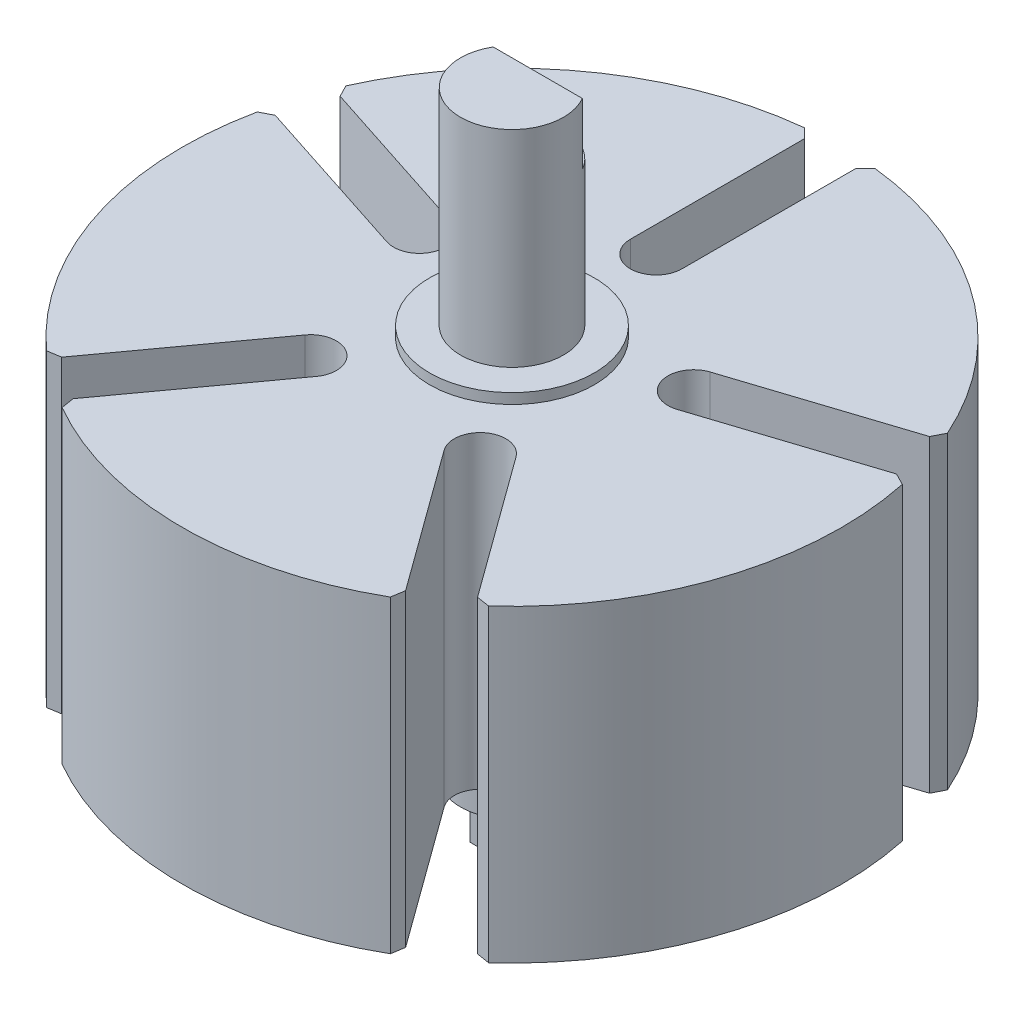
from build123d import *

# Parameters (mm, degrees)
SKETCH_1_R               = 16
EXTRUDE_1_DEPTH          = 15
SKETCH_2_R               = 4
EXTRUDE_2_DEPTH          = 0.5
EXTRUDE_START            = 0.5
SKETCH_3_R               = 4
EXTRUDE_3_DEPTH          = 0.5
SKETCH_4_R               = 2.5
EXTRUDE_4_DEPTH          = 10
EXTRUDE_START_2          = 3
SKETCH_5_R               = 2.5
EXTRUDE_5_DEPTH          = 3
CUT_EXTRUDE_START        = -3
CUT_EXTRUDE_1_DEPTH      = 3
CUT_EXTRUDE_2_DEPTH      = 30.227555491
PATTERN_CIRCULAR_1_COUNT = 5
SKETCH_8_R               = 1.5
EXTRUDE_6_DEPTH          = 3
CHAMFER_1_SIZE           = 0.5
CUT_EXTRUDE_3_DEPTH      = 3


with BuildPart() as part:
    # 草图1 → 凸台-拉伸1 (new body)
    with BuildSketch(Plane(origin=(0, 0, 0), x_dir=(1, 0, 0), z_dir=(0, 1, 0))):
        with Locations(Location((0, 0, 0), (0, 0, 270))):
            Circle(SKETCH_1_R)
    extrude(amount=EXTRUDE_1_DEPTH)

    # 草图2 → 凸台-拉伸2 (add)
    with BuildSketch(Plane(origin=(0, 15, 0), x_dir=(1, 0, 0), z_dir=(0, 1, 0))):
        with Locations(Location((0, 0, 0), (0, 0, 270))):
            Circle(SKETCH_2_R)
    extrude(amount=EXTRUDE_2_DEPTH)

    # 草图3 → 凸台-拉伸3 (add)
    with BuildSketch(Plane.XZ.offset(EXTRUDE_START)):
        with Locations(Location((0, 0, 0), (0, 0, 90))):
            Circle(SKETCH_3_R)
    extrude(amount=-EXTRUDE_3_DEPTH)

    # 草图4 → 凸台-拉伸4 (add)
    with BuildSketch(Plane(origin=(0, 15.5, 0), x_dir=(1, 0, 0), z_dir=(0, 1, 0))):
        with Locations(Location((0, 0, 0), (0, 0, 270))):
            Circle(SKETCH_4_R)
    extrude(amount=EXTRUDE_4_DEPTH)

    # 草图5 → 凸台-拉伸5 (add)
    with BuildSketch(Plane.XZ.offset(0.5).offset(EXTRUDE_START_2)):
        with Locations(Location((0, 0, 0), (0, 0, 90))):
            Circle(SKETCH_5_R)
    extrude(amount=-EXTRUDE_5_DEPTH)

    # 草图6 → 切除-拉伸1 (cut)
    with BuildSketch(Plane(origin=(0, 25.5, 0), x_dir=(1, 0, 0), z_dir=(0, 1, 0)).offset(CUT_EXTRUDE_START)):
        with BuildLine():
            Line((-2.165063509, 1.25), (2.165063509, 1.25))
            ThreePointArc((2.165063509, 1.25), (0, 2.5), (-2.165063509, 1.25))
        make_face()
    extrude(amount=CUT_EXTRUDE_1_DEPTH, mode=Mode.SUBTRACT)

    # 草图7 → 切除-拉伸2 (cut, through all)
    with BuildSketch(Plane(origin=(0, 15, 0), x_dir=(1, 0, 0), z_dir=(0, 1, 0))):
        with BuildLine():
            Line((-1.25, 7), (-1.25, 19))
            Line((-1.25, 19), (1.25, 19))
            Line((1.25, 19), (1.25, 7))
            ThreePointArc((1.25, 7), (0, 5.75), (-1.25, 7))
        make_face()
    cut_extrude_2 = extrude(amount=-CUT_EXTRUDE_2_DEPTH, mode=Mode.SUBTRACT)

    # 阵列(圆周)1: 切除-拉伸2 ×5 about axis
    pattern_circular_1_axis = Axis((0, 0, 0), (0, 1, 0))
    for i in range(1, PATTERN_CIRCULAR_1_COUNT):
        add(cut_extrude_2.rotate(pattern_circular_1_axis, i * 360 / PATTERN_CIRCULAR_1_COUNT), mode=Mode.SUBTRACT)

    # 草图8 → 凸台-拉伸6 (add)
    with BuildSketch(Plane.XZ.offset(3.5)):
        with Locations(Location((0, 0, 0), (0, 0, 270))):
            Circle(SKETCH_8_R)
    extrude(amount=EXTRUDE_6_DEPTH)

    # 倒角1
    # the kernel refuses this chamfer: 0.5, 0.465086612 mm, written as the material it takes off along each edge
    with BuildSketch(Plane(origin=(-1.25, 16.285841494, -15.951097141), x_dir=(-0.9957189737161891, 0, 0.0924322745667282), z_dir=(0, -1, 0)), Plane(origin=(14.784123635, 16.285841494, -6.117980741), x_dir=(-0.3956024015425532, 0, -0.9184218746816544), z_dir=(0, -1, 0)), Plane(origin=(10.3870909, 16.285841494, 12.169977101), x_dir=(0.7512232435318049, 0, -0.6600482091313895), z_dir=(0, -1, 0)), Plane(origin=(-8.364548414, 16.285841494, 13.639440231), x_dir=(0.8598838991841529, 0, 0.5104896472249537), z_dir=(0, -1, 0)), Plane(origin=(-15.556666121, 16.285841494, -3.74033945), x_dir=(-0.21978576745721443, 0, 0.9755481620213546), z_dir=(0, -1, 0))) as chamfer_1_piece_1:
        with BuildLine():
            Line((0.459494947, 0), (CHAMFER_1_SIZE * 0.0924322745667, -CHAMFER_1_SIZE * 0.995718973716))
            Line((CHAMFER_1_SIZE * 0.0924322745667, -CHAMFER_1_SIZE * 0.995718973716), (0, 0))
            ThreePointArc((0, 0), (0.236132262, 0.001648308), (0.459494947, 0))
        make_face()
    extrude(amount=17.571682988, mode=Mode.SUBTRACT)
    with BuildSketch(Plane(origin=(1.25, 16.285841494, -15.951097141), x_dir=(0, 0, 1), z_dir=(0, -1, 0)), Plane(origin=(15.556666121, 16.285841494, -3.74033945), x_dir=(-0.9510565162951534, 0, 0.3090169943749483), z_dir=(0, -1, 0)), Plane(origin=(8.364548414, 16.285841494, 13.639440231), x_dir=(-0.587785252292472, 0, -0.8090169943749483), z_dir=(0, -1, 0)), Plane(origin=(-14.784123635, 16.285841494, -6.117980741), x_dir=(0.9510565162951535, 0, 0.3090169943749477), z_dir=(0, -1, 0))) as chamfer_1_piece_2:
        with BuildLine():
            Line((CHAMFER_1_SIZE, 0), (0.042472163, -0.457527837))
            ThreePointArc((0.042472163, -0.457527837), (0.020184991, -0.235273731), (0, 0))
            Line((0, 0), (CHAMFER_1_SIZE, 0))
        make_face()
    extrude(amount=17.571682988, mode=Mode.SUBTRACT)
    with BuildSketch(Plane(origin=(-10.3870909, 16.285841494, 12.169977101), x_dir=(-0.7512232435318061, 0, -0.6600482091313881), z_dir=(0, -1, 0))) as chamfer_1_piece_3:
        with BuildLine():
            Line((0.459494947, 0), (CHAMFER_1_SIZE * 0.0924322745667, CHAMFER_1_SIZE * 0.995718973716))
            Line((CHAMFER_1_SIZE * 0.0924322745667, CHAMFER_1_SIZE * 0.995718973716), (0, 0))
            ThreePointArc((0, 0), (0.236132262, -0.001648308), (0.459494947, 0))
        make_face()
    extrude(amount=17.571682988, mode=Mode.SUBTRACT)

    # 草图9 → 切除-拉伸3 (cut)
    with BuildSketch(Plane.XZ.offset(6.5).offset(CUT_EXTRUDE_START)):
        with BuildLine():
            Line((-1.299038106, 0.75), (1.299038106, 0.75))
            ThreePointArc((1.299038106, 0.75), (0, 1.5), (-1.299038106, 0.75))
        make_face()
    extrude(amount=CUT_EXTRUDE_3_DEPTH, mode=Mode.SUBTRACT)


solid = part.part
